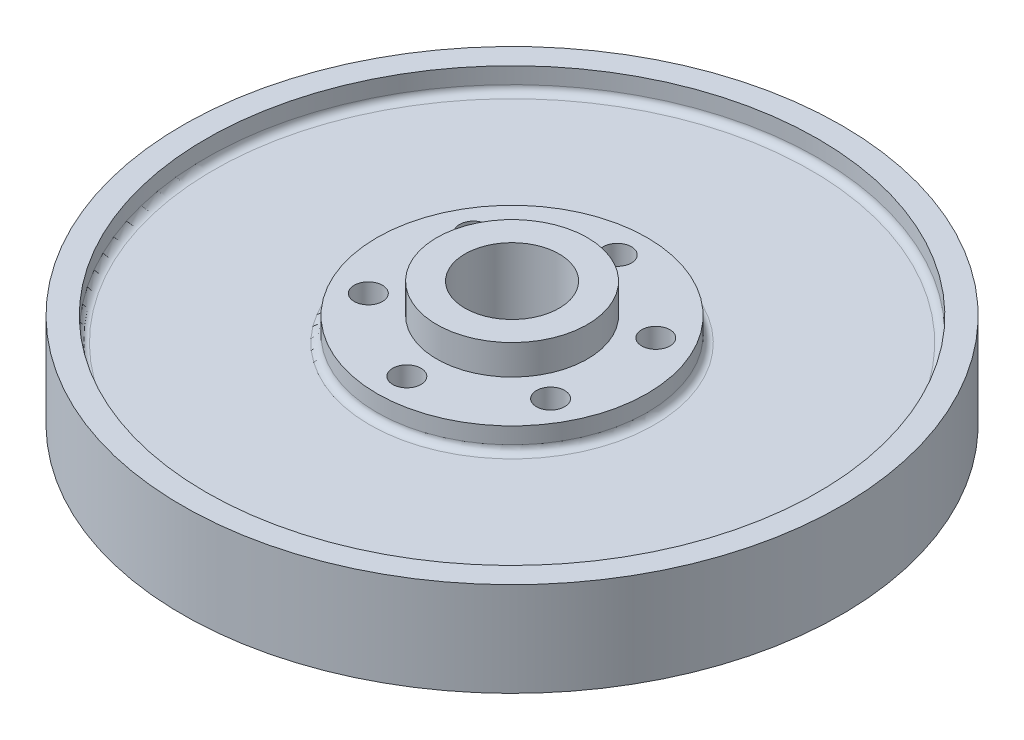
from build123d import *

# Parameters (mm, degrees)
HUB_FILLETS_R          = 0.762
F_4_0MM_DOWEL_HOLE1_D  = 3
CIRPATTERN1_COUNT      = 6
F_10_0MM_DOWEL_HOLE1_D = 10


with BuildPart() as part:
    # Sketch1 → Main Body (revolve)
    with BuildSketch(Plane.XY):
        Polygon((0, 0), (0, 10.000000066), (0, 13.175000066), (8.000000002, 13.175000066), (8.000000002, 10.000000066), (14.350000002, 10.000000066), (14.350000002, 7.499999986), (32.49999992, 7.499999986), (32.49999992, 10.000000033), (35, 10.000000033), (35, 3.3e-08), (32.49999992, 3.3e-08), (32.49999992, 2.50000008), (14.350000002, 2.50000008), (14.350000002, 0), align=None)
    revolve(axis=Axis((0, 0, 0), (0, 1, 0)))

    # Hub Fillets
    hub_fillets_edges = [part.edges().sort_by_distance(p)[0] for p in [
        (-14.350000002, 7.499999986, 0),
        (-32.49999992, 7.499999986, 0),
        (-14.350000002, 2.50000008, 0),
        (-32.49999992, 2.50000008, 0),
    ]]
    fillet(hub_fillets_edges, radius=HUB_FILLETS_R)

    # Ø4.0mm Dowel Hole1 (through all)
    with Locations(Plane(origin=(0, 0, 0), x_dir=(-1, 0, 0), z_dir=(0, -1, 0))):
        with Locations((0, 11.175)):
            f_4_0mm_dowel_hole1 = Hole(F_4_0MM_DOWEL_HOLE1_D / 2)

    # CirPattern1: Ø4.0mm Dowel Hole1 ×6 about axis
    cirpattern1_axis = Axis((0, 0, 0), (0, -1, 0))
    for i in range(1, CIRPATTERN1_COUNT):
        add(f_4_0mm_dowel_hole1.rotate(cirpattern1_axis, i * 360 / CIRPATTERN1_COUNT), mode=Mode.SUBTRACT)

    # Ø10.0mm Dowel Hole1 (through all)
    with Locations(Plane(origin=(0, 13.175000066, 0), x_dir=(1, 0, 0), z_dir=(0, 1, 0))):
        with Locations((0, 0)):
            Hole(F_10_0MM_DOWEL_HOLE1_D / 2)


solid = part.part
